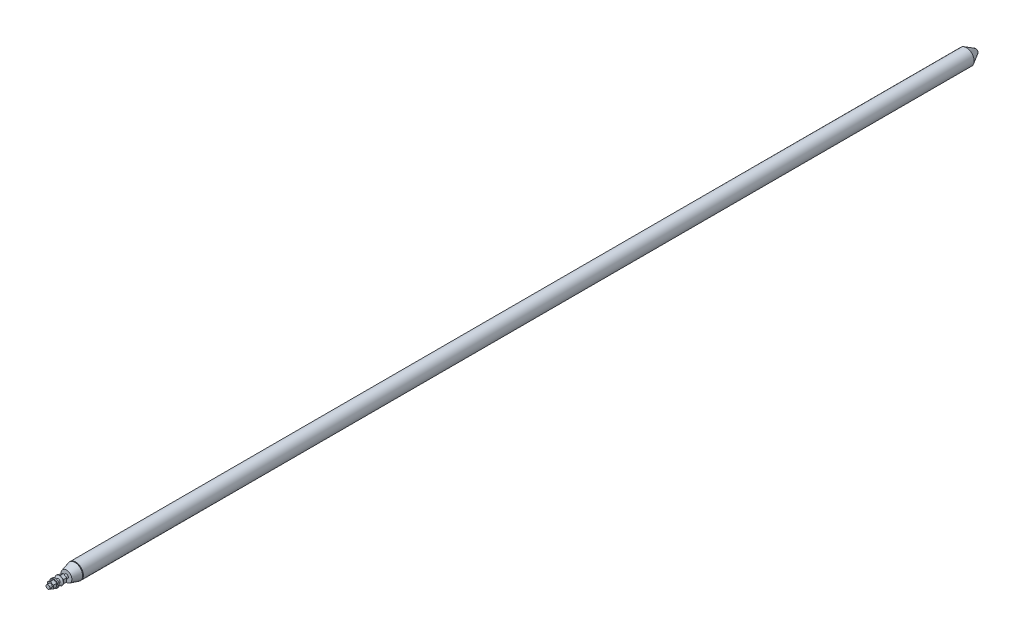
from build123d import *

# Parameters (mm, degrees)
BOSS_REVOLVE3_START         = 12.690475
BOSS_REVOLVE3_OUTLINE_R     = 7.9375
BOSS_REVOLVE3_DEPTH         = 15.478125
BOSS_REVOLVE3_START_2       = 46.292398399
BOSS_REVOLVE3_2_OUTLINE_R   = 16.6751
BOSS_REVOLVE3_2_OUTLINE_R_2 = 7.9375
BOSS_REVOLVE3_2_DEPTH       = 5.8166
BOSS_EXTRUDE2_DEPTH         = 13.890625


# Read off the part's stored shape, not the designer's step: Boss-Revolve3
with BuildPart() as part:
    # Sketch1 → Base-Revolve (revolve)
    with BuildSketch(Plane(origin=(0, 0, 0), x_dir=(0, 0, -1), z_dir=(1, 0, 0)), mode=Mode.PRIVATE) as base_revolve_sk:
        Polygon((-76.2, 0), (-76.2, 7.9375), (0, 7.9375), (0, 22.225), (34.895210283, 31.75), (38.1, 28.575), (47.625, 28.575), (47.625, 0), align=None)
    revolve(base_revolve_sk.sketch.rotate(Axis((0, 0, 0), (0, 0, 1)), 90), axis=Axis((0, 0, 0), (0, 0, 1)))

    # Sketch3 → Boss-Revolve2 (revolve)
    with BuildSketch(Plane(origin=(0, 0, 0), x_dir=(0, 0, -1), z_dir=(1, 0, 0)), mode=Mode.PRIVATE) as boss_revolve2_sk:
        with BuildLine():
            Line((-28.1686, 0), (-28.1686, 17.4625))
            Line((-28.1686, 17.4625), (-29.7688, 17.4625))
            ThreePointArc((-29.7688, 17.4625), (-33.309963658, 9.048473715), (-34.5186, 0))
            Line((-34.5186, 0), (-28.1686, 0))
        make_face()
    revolve(boss_revolve2_sk.sketch.rotate(Axis((0, 0, 0), (0, 0, 1)), 90), axis=Axis((0, 0, 0), (0, 0, 1)))

    # Sketch2 → Boss-Revolve1 (revolve)
    with BuildSketch(Plane(origin=(0, 0, 0), x_dir=(0, 0, -1), z_dir=(1, 0, 0)), mode=Mode.PRIVATE) as boss_revolve1_sk:
        with BuildLine():
            Line((38.1, 31.75), (38.1, 28.5623))
            Line((38.1, 28.5623), (3705.364265314, 28.5623))
            Line((3705.364265314, 28.5623), (3705.364265314, 0))
            Line((3705.364265314, 0), (3747.656878454, 0))
            ThreePointArc((3747.656878454, 0), (3745.955401082, 6.35), (3741.306878454, 10.998522628))
            Line((3741.306878454, 10.998522628), (3705.364265314, 31.75))
            Line((3705.364265314, 31.75), (38.1, 31.75))
        make_face()
    revolve(boss_revolve1_sk.sketch.rotate(Axis((0, 0, 29.7434), (0, 0, -1)), 90), axis=Axis((0, 0, 29.7434), (0, 0, -1)))

    # Boss-Revolve3 outline → Boss-Revolve3 (add)
    with BuildSketch(Plane.XY.offset(BOSS_REVOLVE3_START)):
        Polygon((0, -15.588572738), (13.5001, -7.794286369), (13.5001, 7.794286369), (0, 15.588572738), (-13.5001, 7.794286369), (-13.5001, -7.794286369), align=None)
        Circle(BOSS_REVOLVE3_OUTLINE_R, mode=Mode.SUBTRACT)
    extrude(amount=BOSS_REVOLVE3_DEPTH)

    # Boss-Revolve3 2 outline → Boss-Revolve3 2 (add)
    with BuildSketch(Plane.XY.offset(BOSS_REVOLVE3_START_2)):
        Circle(BOSS_REVOLVE3_2_OUTLINE_R)
        Circle(BOSS_REVOLVE3_2_OUTLINE_R_2, mode=Mode.SUBTRACT)
    extrude(amount=BOSS_REVOLVE3_2_DEPTH)

    # Sketch6 → Boss-Extrude2 (add)
    with BuildSketch(Plane.XY.offset(52.108998399)):
        Polygon((0, -13.755485633), (11.9126, -6.877742817), (11.9126, 6.877742817), (0, 13.755485633), (-11.9126, 6.877742817), (-11.9126, -6.877742817), align=None)
    extrude(amount=BOSS_EXTRUDE2_DEPTH)


solid = part.part
